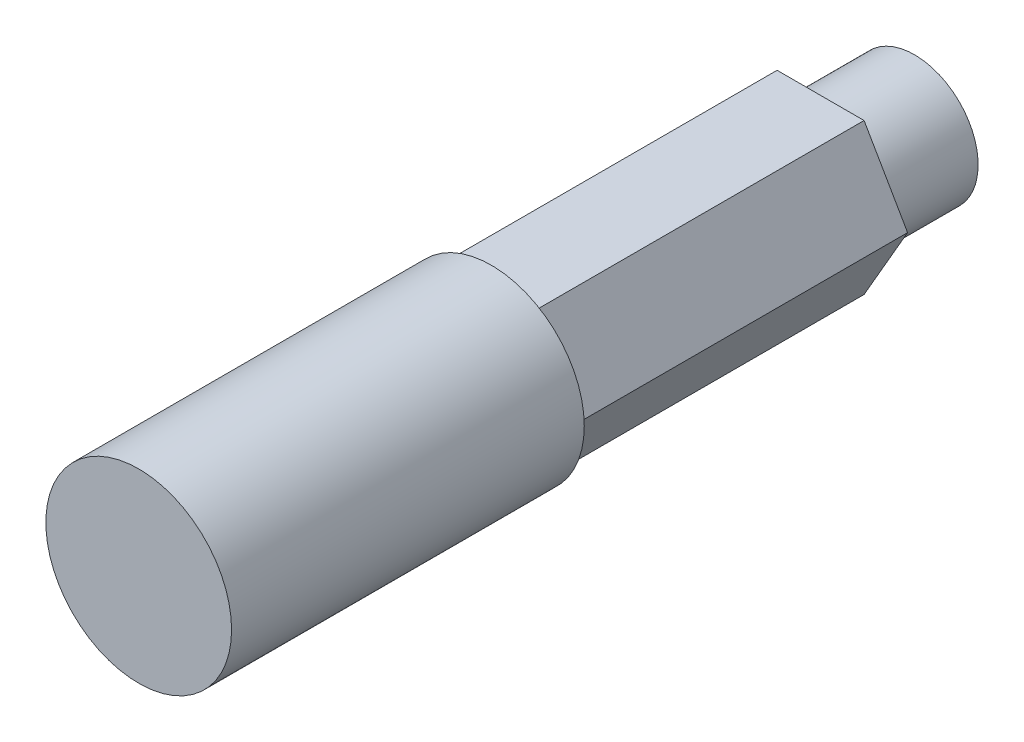
from build123d import *

# Parameters (mm, degrees)
BOSS_EXTRUDE1_DEPTH = 14
SKETCH2_R           = 3.95
BOSS_EXTRUDE2_DEPTH = 15
SKETCH3_R           = 2.7
BOSS_EXTRUDE3_DEPTH = 4


with BuildPart() as part:
    # Sketch1 → Boss-Extrude1 (new body)
    with BuildSketch(Plane.XY):
        Polygon((3.7, 0), (1.85, 3.204293994), (-1.85, 3.204293994), (-3.7, 0), (-1.85, -3.204293994), (1.85, -3.204293994), align=None)
    extrude(amount=BOSS_EXTRUDE1_DEPTH)

    # Sketch2 → Boss-Extrude2 (add)
    with BuildSketch(Plane.XY.offset(14)):
        Circle(SKETCH2_R)
    extrude(amount=BOSS_EXTRUDE2_DEPTH)

    # Sketch3 → Boss-Extrude3 (add)
    with BuildSketch(Plane(origin=(0, 0, 0), x_dir=(-1, 0, 0), z_dir=(0, 0, -1))):
        Circle(SKETCH3_R)
    extrude(amount=BOSS_EXTRUDE3_DEPTH)


solid = part.part
